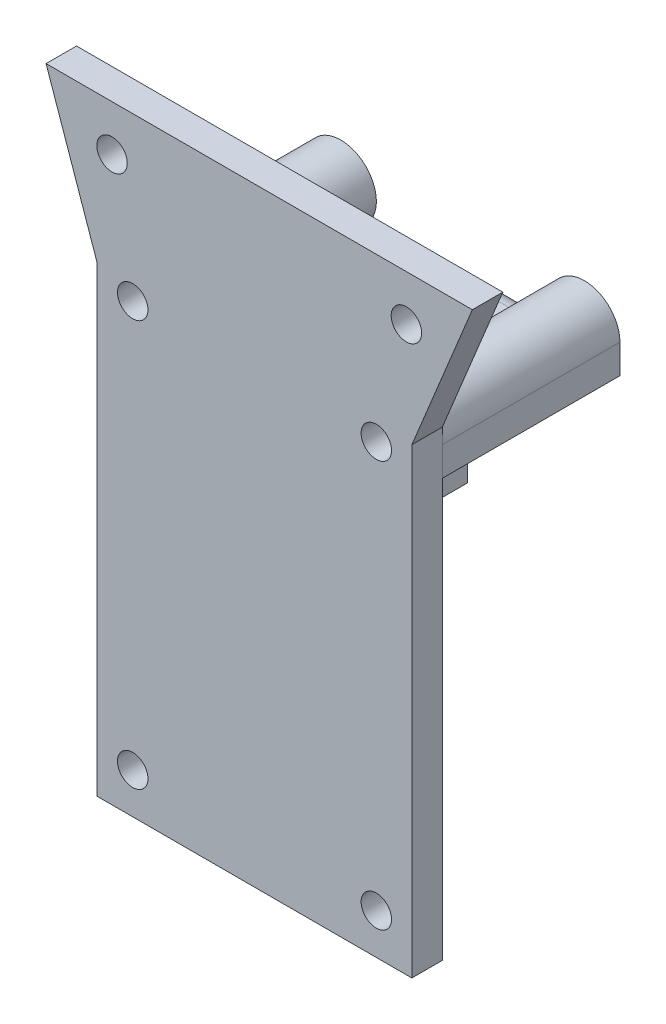
from build123d import *
from build123d.topology import SkipClean

# Parameters (mm, degrees)
SKETCH1_R           = 1.5
BOSS_EXTRUDE1_DEPTH = 3
SKETCH2_R           = 2.5
BOSS_EXTRUDE2_DEPTH = 1.5
SKETCH5_R           = 2.5
BOSS_EXTRUDE5_DEPTH = 14
SKETCH6_R           = 2.5
BOSS_EXTRUDE6_DEPTH = 2
SKETCH8_W           = 9.5
SKETCH8_H           = 15
CUT_EXTRUDE1_DEPTH  = 3
CUT_EXTRUDE2_REACH  = 56.155
SKETCH9_W           = 12
SKETCH9_H           = 8
SKETCH11_W          = 8
SKETCH11_H          = 4
CUT_EXTRUDE4_DEPTH  = 2
SKETCH13_W          = 5
SKETCH13_H          = 15
CUT_EXTRUDE7_DEPTH  = 1.5
SKETCH15_W          = 12
SKETCH15_H          = 9.5
CUT_EXTRUDE8_DEPTH  = 2
SKETCH16_W          = 7
SKETCH16_H          = 3
CUT_EXTRUDE9_DEPTH  = 72.346897019
FILLET1_R           = 2
CUT_EXTRUDE11_REACH = 75.393
SKETCH21_W          = 9
SKETCH21_H          = 10.636038969
SKETCH23_R          = 6
BOSS_EXTRUDE7_DEPTH = 2
FILLET2_R           = 2


with BuildPart() as part:
    # Sketch1 → Boss-Extrude1 (new body)
    with BuildSketch(Plane.XY):
        Polygon((0, 0), (31, 0), (31, 45.5), (36.963007518, 60), (-5.036992482, 60), (0, 45.5), align=None)
        with Locations((30.463007518, 55.5)):
            Circle(SKETCH1_R, mode=Mode.SUBTRACT)
        with Locations((27.5, 44)):
            Circle(SKETCH1_R, mode=Mode.SUBTRACT)
        with Locations((27.5, 4)):
            Circle(SKETCH1_R, mode=Mode.SUBTRACT)
        with Locations((3.5, 4)):
            Circle(SKETCH1_R, mode=Mode.SUBTRACT)
        with Locations((3.5, 44)):
            Circle(SKETCH1_R, mode=Mode.SUBTRACT)
        with Locations((1.463007518, 55.5)):
            Circle(SKETCH1_R, mode=Mode.SUBTRACT)
    extrude(amount=BOSS_EXTRUDE1_DEPTH)


with BuildPart() as body_2:
    # Sketch2 → Boss-Extrude2 (new body)
    with BuildSketch(Plane(origin=(0, 0, 0), x_dir=(-1, 0, 0), z_dir=(0, 0, -1))):
        with BuildLine():
            Line((0, 24.5), (0, 44))
            ThreePointArc((0, 44), (-3.750643519, 47.491013868), (-6.964101615, 43.5))
            Line((-6.964101615, 43.5), (-24.035898385, 43.5))
            ThreePointArc((-24.035898385, 43.5), (-27.249356481, 47.491013868), (-31, 44))
            Line((-31, 44), (-31, 41.136038969))
            Line((-31, 41.136038969), (-25, 35.136038969))
            Line((-25, 35.136038969), (-25, 28.5))
            Line((-25, 28.5), (-18, 28.5))
            Line((-18, 28.5), (-18, 24.5))
            Line((-18, 24.5), (0, 24.5))
        make_face()
        with Locations((-27.5, 44)):
            Circle(SKETCH2_R, mode=Mode.SUBTRACT)
        with Locations((-3.5, 44)):
            Circle(SKETCH2_R, mode=Mode.SUBTRACT)
    extrude(amount=BOSS_EXTRUDE2_DEPTH)

    # Sketch5 → Boss-Extrude5 (add)
    with SkipClean():  # the faces are left unmerged after this step: merging them gives an invalid solid
        with BuildSketch(Plane(origin=(0, 0, -1.5), x_dir=(-1, 0, 0), z_dir=(0, 0, -1))):
            with BuildLine():
                Line((-6.964101615, 43.5), (-24.035898385, 43.5))
                ThreePointArc((-24.035898385, 43.5), (-27.249356481, 47.491013868), (-31, 44))
                Line((-31, 44), (-31, 41.136038969))
                Line((-31, 41.136038969), (-25, 35.136038969))
                Line((-25, 35.136038969), (-25, 28.5))
                Line((-25, 28.5), (-18, 28.5))
                Line((-18, 28.5), (-18, 24.5))
                Line((-18, 24.5), (0, 24.5))
                Line((0, 24.5), (0, 44))
                ThreePointArc((0, 44), (-3.750643519, 47.491013868), (-6.964101615, 43.5))
            make_face()
            with Locations((-27.5, 44)):
                Circle(SKETCH5_R, mode=Mode.SUBTRACT)
            with BuildLine():
                Line((-23, 41.5), (-5.5, 41.5))
                Line((-5.5, 41.5), (-5.5, 42.5))
                ThreePointArc((-5.5, 42.5), (-3.146446609, 46.474873734), (-2, 42))
                Line((-2, 42), (-2, 26.5))
                Line((-2, 26.5), (-16, 26.5))
                Line((-16, 26.5), (-16, 30.5))
                Line((-16, 30.5), (-23, 30.5))
                Line((-23, 30.5), (-23, 41.5))
            make_face(mode=Mode.SUBTRACT)
        extrude(amount=BOSS_EXTRUDE5_DEPTH)

    # Sketch6 → Boss-Extrude6 (add)
    with SkipClean():  # the faces are left unmerged after this step: merging them gives an invalid solid
        with BuildSketch(Plane(origin=(0, 0, -15.5), x_dir=(-1, 0, 0), z_dir=(0, 0, -1))):
            with BuildLine():
                Line((-6.964101615, 43.5), (-24.035898385, 43.5))
                ThreePointArc((-24.035898385, 43.5), (-27.249356481, 47.491013868), (-31, 44))
                Line((-31, 44), (-31, 41.136038969))
                Line((-31, 41.136038969), (-25, 35.136038969))
                Line((-25, 35.136038969), (-25, 28.5))
                Line((-25, 28.5), (-18, 28.5))
                Line((-18, 28.5), (-18, 24.5))
                Line((-18, 24.5), (0, 24.5))
                Line((0, 24.5), (0, 44))
                ThreePointArc((0, 44), (-3.750643519, 47.491013868), (-6.964101615, 43.5))
            make_face()
            with Locations((-3.5, 44)):
                Circle(SKETCH6_R, mode=Mode.SUBTRACT)
            with Locations((-27.5, 44)):
                Circle(SKETCH6_R, mode=Mode.SUBTRACT)
        extrude(amount=BOSS_EXTRUDE6_DEPTH)

    # Sketch8 → Cut-Extrude1 (cut)
    with SkipClean():  # the faces are left unmerged after this step: merging them gives an invalid solid
        with BuildSketch(Plane.ZY):
            with Locations((-8.75, 32)):
                Rectangle(SKETCH8_W, SKETCH8_H)
        extrude(amount=-CUT_EXTRUDE1_DEPTH, mode=Mode.SUBTRACT)

    # Cut-Extrude2: up to this face of the body (flat: up to its plane)
    cut_extrude2_end = Plane(body_2.part.faces().sort_by_distance((21.5, 28.5, -8.5))[0])
    # Sketch9 → Cut-Extrude2 (cut, up to the picked face)
    with BuildSketch(Plane.XZ.offset(-24.5), mode=Mode.PRIVATE) as cut_extrude2_sk1:
        with Locations((16, -4)):
            Rectangle(SKETCH9_W, SKETCH9_H)
    cut_extrude2_tool1 = split(extrude(cut_extrude2_sk1.sketch, amount=-CUT_EXTRUDE2_REACH, mode=Mode.PRIVATE), bisect_by=cut_extrude2_end, keep=Keep.BOTH, mode=Mode.PRIVATE)
    add(cut_extrude2_tool1.solids().sort_by(Axis((16, 24.5, -4), (0, 1, 0)))[0], mode=Mode.SUBTRACT)

    # Sketch11 → Cut-Extrude4 (cut)
    with SkipClean():  # the faces are left unmerged after this step: merging them gives an invalid solid
        with BuildSketch(Plane(origin=(25, 0, 0), x_dir=(0, 0, -1), z_dir=(1, 0, 0))):
            with Locations((8, 32.5)):
                Rectangle(SKETCH11_W, SKETCH11_H)
        extrude(amount=-CUT_EXTRUDE4_DEPTH, mode=Mode.SUBTRACT)

    # Sketch13 → Cut-Extrude7 (cut)
    with SkipClean():  # the faces are left unmerged after this step: merging them gives an invalid solid
        with BuildSketch(Plane.XY):
            with Locations((15.5, 36)):
                Rectangle(SKETCH13_W, SKETCH13_H)
        extrude(amount=-CUT_EXTRUDE7_DEPTH, mode=Mode.SUBTRACT)

    # Sketch15 → Cut-Extrude8 (cut)
    with SkipClean():  # the faces are left unmerged after this step: merging them gives an invalid solid
        with BuildSketch(Plane(origin=(0, 43.5, 0), x_dir=(1, 0, 0), z_dir=(0, 1, 0))):
            with Locations((15.5, 4.75)):
                Rectangle(SKETCH15_W, SKETCH15_H)
        extrude(amount=-CUT_EXTRUDE8_DEPTH, mode=Mode.SUBTRACT)

    # Sketch16 → Cut-Extrude9 (cut, through all)
    with SkipClean():  # the faces are left unmerged after this step: merging them gives an invalid solid
        with BuildSketch(Plane(origin=(-5.068019485, 5.068019485, 0), x_dir=(0, 0, -1), z_dir=(0.7071067811865467, -0.7071067811865485, 0))):
            with Locations((7.5, 48.108387387)):
                Rectangle(SKETCH16_W, SKETCH16_H)
        extrude(amount=-CUT_EXTRUDE9_DEPTH, mode=Mode.SUBTRACT)

    # Fillet1
    # the kernel refuses this fillet: 2 mm, written as the material it adds along each edge
    with BuildSketch(Plane(origin=(2, 26.5, -1.5), x_dir=(1, 0, 0), z_dir=(0, 0, -1))) as fillet1_piece_1_section:
        with BuildLine():
            CenterArc((FILLET1_R, -FILLET1_R), FILLET1_R, 90, 90)
            Line((0, -FILLET1_R), (0, 0))
            Line((0, 0), (FILLET1_R, 0))
        make_face()
    fillet1_piece_1 = extrude(amount=7.5, mode=Mode.PRIVATE)
    fillet1_piece_1 = split(fillet1_piece_1, bisect_by=Plane(origin=(3, 26.579369185, -2.75), z_dir=(1, 0, 0)), keep=Keep.TOP, mode=Mode.PRIVATE)
    add(fillet1_piece_1)
    with BuildSketch(Plane(origin=(2, 26.5, -1.5), x_dir=(1, 0, 0), z_dir=(0, 0, -1))) as fillet1_piece_2:
        with BuildLine():
            CenterArc((FILLET1_R, -FILLET1_R), FILLET1_R, 90, 90)
            Line((0, -FILLET1_R), (0, 0))
            Line((0, 0), (FILLET1_R, 0))
        make_face()
    extrude(amount=2.5)
    with BuildSketch(Plane(origin=(18, 28.5, -8), x_dir=(0, -1, 0), z_dir=(0, 0, -1))) as fillet1_piece_3:
        with BuildLine():
            CenterArc((FILLET1_R, -FILLET1_R), FILLET1_R, 90, 90)
            Line((0, -FILLET1_R), (0, 0))
            Line((0, 0), (FILLET1_R, 0))
        make_face()
    extrude(amount=7.5)
    with BuildSketch(Plane(origin=(28, 41.5, -15.5), x_dir=(0, 0, 1), z_dir=(-1, 0, 0))) as fillet1_piece_4:
        with BuildLine():
            CenterArc((FILLET1_R, -FILLET1_R), FILLET1_R, 90, 90)
            Line((0, -FILLET1_R), (0, 0))
            Line((0, 0), (FILLET1_R, 0))
        make_face()
    extrude(amount=22.5)
    with BuildSketch(Plane(origin=(2, 26.5, -8.5), x_dir=(1, 0, 0), z_dir=(0, 0, -1))) as fillet1_piece_5_section:
        with BuildLine():
            CenterArc((FILLET1_R, -FILLET1_R), FILLET1_R, 90, 90)
            Line((0, -FILLET1_R), (0, 0))
            Line((0, 0), (FILLET1_R, 0))
        make_face()
    fillet1_piece_5 = extrude(amount=7, mode=Mode.PRIVATE)
    fillet1_piece_5 = split(fillet1_piece_5, bisect_by=Plane(origin=(3, 26.579369185, -11), z_dir=(1, 0, 0)), keep=Keep.TOP, mode=Mode.PRIVATE)
    add(fillet1_piece_5)
    with BuildSketch(Plane(origin=(2, 26.5, -13.5), x_dir=(1, 0, 0), z_dir=(0, 0, -1)), Plane(origin=(18, 28.5, -15.5), x_dir=(0, -1, 0), z_dir=(0, 0, -1))) as fillet1_piece_6:
        with BuildLine():
            CenterArc((FILLET1_R, -FILLET1_R), FILLET1_R, 90, 90)
            Line((0, -FILLET1_R), (0, 0))
            Line((0, 0), (FILLET1_R, 0))
        make_face()
    extrude(amount=2)
    # the kernel refuses this fillet: 2 mm, written as the material it takes off along each edge
    with BuildSketch(Plane(origin=(0, 24.5, -1.5), x_dir=(0, 1, 0), z_dir=(0, 0, -1))) as fillet1_2_piece_1:
        with BuildLine():
            CenterArc((FILLET1_R, FILLET1_R), FILLET1_R, 180, 90)
            Line((0, FILLET1_R), (0, 0))
            Line((0, 0), (FILLET1_R, 0))
        make_face()
    extrude(amount=7.5, mode=Mode.SUBTRACT)
    with BuildSketch(Plane(origin=(0, 24.5, -15.5), x_dir=(0, 1, 0), z_dir=(0, 0, -1)), Plane(origin=(18, 24.5, -15.5), x_dir=(-1, 0, 0), z_dir=(0, 0, -1)), Plane(origin=(0, 24.5, -8.5), x_dir=(0, 1, 0), z_dir=(0, 0, -1))) as fillet1_2_piece_2:
        with BuildLine():
            CenterArc((FILLET1_R, FILLET1_R), FILLET1_R, 180, 90)
            Line((0, FILLET1_R), (0, 0))
            Line((0, 0), (FILLET1_R, 0))
        make_face()
    extrude(amount=7, mode=Mode.SUBTRACT)
    with BuildSketch(Plane(origin=(18, 24.5, -3), x_dir=(-1, 0, 0), z_dir=(0, 0, -1))) as fillet1_2_piece_3:
        with BuildLine():
            CenterArc((FILLET1_R, FILLET1_R), FILLET1_R, 180, 90)
            Line((0, FILLET1_R), (0, 0))
            Line((0, 0), (FILLET1_R, 0))
        make_face()
    extrude(amount=12.5, mode=Mode.SUBTRACT)
    with BuildSketch(Plane(origin=(25, 28.5, -1.5), x_dir=(-1, 0, 0), z_dir=(0, 0, -1))) as fillet1_2_piece_4:
        with BuildLine():
            CenterArc((FILLET1_R, FILLET1_R), FILLET1_R, 180, 90)
            Line((0, FILLET1_R), (0, 0))
            Line((0, 0), (FILLET1_R, 0))
        make_face()
    extrude(amount=14, mode=Mode.SUBTRACT)
    with BuildSketch(Plane(origin=(13, 28.5, 5), x_dir=(-1, 0, 0), z_dir=(0, 0, -1)), Plane(origin=(18, 41.5, 5), x_dir=(1, 0, 0), z_dir=(0, 0, -1))) as fillet1_2_piece_5:
        with BuildLine():
            CenterArc((FILLET1_R, FILLET1_R), FILLET1_R, 180, 90)
            Line((0, FILLET1_R), (0, 0))
            Line((0, 0), (FILLET1_R, 0))
        make_face()
    extrude(amount=11.5, mode=Mode.SUBTRACT)
    with BuildSketch(Plane(origin=(18, 28.5, 5), x_dir=(0, 1, 0), z_dir=(0, 0, -1)), Plane(origin=(25, 28.5, 5), x_dir=(-1, 0, 0), z_dir=(0, 0, -1)), Plane(origin=(0, 24.5, 5), x_dir=(0, 1, 0), z_dir=(0, 0, -1))) as fillet1_2_piece_6:
        with BuildLine():
            CenterArc((FILLET1_R, FILLET1_R), FILLET1_R, 180, 90)
            Line((0, FILLET1_R), (0, 0))
            Line((0, 0), (FILLET1_R, 0))
        make_face()
    extrude(amount=6.5, mode=Mode.SUBTRACT)
    with BuildSketch(Plane(origin=(13, 41.5, -6.5), x_dir=(0, -1, 0), z_dir=(0, 0, 1))) as fillet1_2_piece_7:
        with BuildLine():
            CenterArc((FILLET1_R, -FILLET1_R), FILLET1_R, 90, 90)
            Line((0, -FILLET1_R), (0, 0))
            Line((0, 0), (FILLET1_R, 0))
        make_face()
    extrude(amount=11.5, mode=Mode.SUBTRACT)
    with BuildSketch(Plane(origin=(16, 30.5, 3.5), x_dir=(0, -1, 0), z_dir=(0, 0, -1))) as fillet1_2_piece_8:
        with BuildLine():
            CenterArc((FILLET1_R, -FILLET1_R), FILLET1_R, 90, 90)
            Line((0, -FILLET1_R), (0, 0))
            Line((0, 0), (FILLET1_R, 0))
        make_face()
    extrude(amount=19, mode=Mode.SUBTRACT)
    with BuildSketch(Plane(origin=(1.964101615, 43.5, -17.5), x_dir=(0, -1, 0), z_dir=(1, 0, 0))) as fillet1_2_piece_9_section:
        with BuildLine():
            CenterArc((FILLET1_R, -FILLET1_R), FILLET1_R, 90, 90)
            Line((0, -FILLET1_R), (0, 0))
            Line((0, 0), (FILLET1_R, 0))
        make_face()
    fillet1_2_piece_9 = extrude(amount=27.07179677, mode=Mode.PRIVATE)
    fillet1_2_piece_9 = fillet1_2_piece_9 - Plane(origin=(3.5, 44, -17.056366893), x_dir=(-1, 0, 0), z_dir=(0, 0, 1)) * Cylinder(3.5, 63, mode=Mode.PRIVATE)
    fillet1_2_piece_9 = fillet1_2_piece_9 - Plane(origin=(27.5, 44, -17.056366893), x_dir=(-0.9897433186107873, -0.14285714285714077, 0), z_dir=(0, 0, 1)) * Cylinder(3.5, 63, mode=Mode.PRIVATE)
    add(fillet1_2_piece_9, mode=Mode.SUBTRACT)
    with BuildSketch(Plane(origin=(25, 28.5, -15.5), x_dir=(0, 1, 0), z_dir=(0, 0, -1))) as fillet1_2_piece_10:
        with BuildLine():
            CenterArc((FILLET1_R, -FILLET1_R), FILLET1_R, 90, 90)
            Line((0, -FILLET1_R), (0, 0))
            Line((0, 0), (FILLET1_R, 0))
        make_face()
    extrude(amount=7, mode=Mode.SUBTRACT)

    # Cut-Extrude11: up to this face of the body (flat: up to its plane)
    cut_extrude11_end = Plane(body_2.part.faces().sort_by_distance((7.302519528, 34.317007669, -1.5))[0])
    # Sketch21 → Cut-Extrude11 (cut, up to the picked face)
    with BuildSketch(Plane(origin=(0, 0, -17.5), x_dir=(-1, 0, 0), z_dir=(0, 0, -1)), mode=Mode.PRIVATE) as cut_extrude11_sk1:
        with Locations((-20.5, 29.818019485)):
            Rectangle(SKETCH21_W, SKETCH21_H)
    cut_extrude11_tool1 = split(extrude(cut_extrude11_sk1.sketch, amount=-CUT_EXTRUDE11_REACH, mode=Mode.PRIVATE), bisect_by=cut_extrude11_end, keep=Keep.BOTH, mode=Mode.PRIVATE)
    add(cut_extrude11_tool1.solids().sort_by(Axis((20.5, 29.818019, -17.5), (0, 0, 1)))[0], mode=Mode.SUBTRACT)

    # Sketch23 → Boss-Extrude7 (add)
    with BuildSketch(Plane.XZ.offset(-24.5)):
        with Locations((9, -8.5)):
            Circle(SKETCH23_R)
    extrude(amount=-BOSS_EXTRUDE7_DEPTH)

    # Fillet2
    fillet2_edges = [body_2.edges().sort_by_distance(p)[0] for p in [
        (1, 39.5, -13.5),
        (1, 39.5, -4),
        (16, 35.136038969, -16.5),
        (24, 35.136038969, -1.5),
    ]]
    fillet(fillet2_edges, radius=FILLET2_R)


solid = Compound([part.part, body_2.part])
